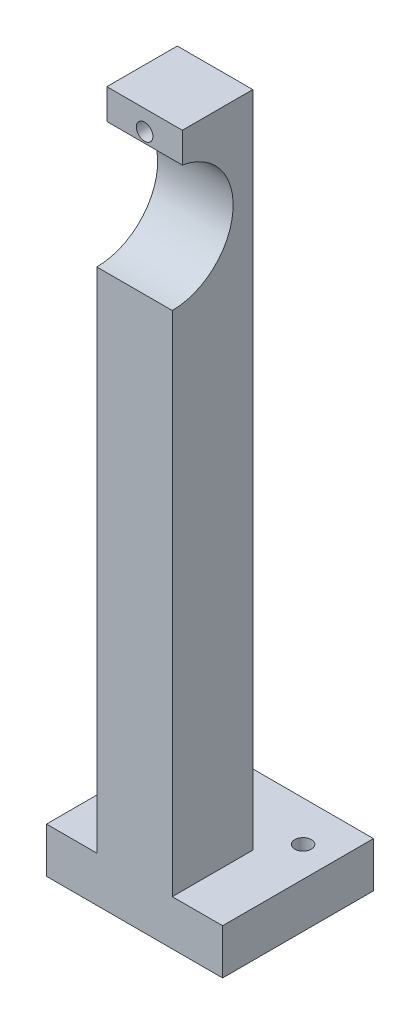
from build123d import *

# Parameters (mm, degrees)
SKETCH_2_W                 = 240.549430728
SKETCH_2_H                 = 149.540933388
EXTRUDE_1_DEPTH            = 5
SKETCH_6_W                 = 93.246571425
SKETCH_6_H                 = 149.540933388
EXTRUDE_4_DEPTH            = 5
SKETCH_8_W                 = 274.716709757
SKETCH_8_H                 = 58.51354913
EXTRUDE_6_DEPTH            = 5
CUT_EXTRUDE_2_DEPTH        = 252.755772101
CUT_EXTRUDE_2_DEPTH_BACK   = 252.755772101
SKETCH_9_W                 = 59.079292396
SKETCH_9_H                 = 149.540933388
SKETCH_10_W                = 104.703380117
SKETCH_10_H                = 208.054482518
CUT_EXTRUDE_3_DEPTH        = 10
SKETCH_12_W                = 200
SKETCH_12_H                = 200
EXTRUDE_7_DEPTH            = 5
SKETCH_13_OUTSIDE_W        = 259.728
SKETCH_13_OUTSIDE_H        = 267.782
SKETCH_13_OUTSIDE_W_2      = 200
SKETCH_13_OUTSIDE_H_2      = 200
CUT_EXTRUDE_4_DEPTH        = 278.64321362
EXTRUDE_START              = -75
SKETCH_18_R                = 5.25
EXTRUDE_9_DEPTH            = 10
EXTRUDE_START_2            = -46
EXTRUDE_10_DEPTH           = 15
EXTRUDE_START_3            = -91.2
EXTRUDE_11_DEPTH           = 15
EXTRUDE_12_REACH           = 307.894
SKETCH_20_R                = 5.25
SKETCH_26_W                = 200
SKETCH_26_H                = 5
EXTRUDE_13_DEPTH           = 100
SKETCH_27_W                = 200
SKETCH_27_H                = 5
CUT_EXTRUDE_5_DEPTH        = 30
EXTRUDE_14_DEPTH           = 10
SKETCH_29_W                = 60
SKETCH_29_H                = 9
EXTRUDE_15_DEPTH           = 10
HOLE_WIZARD_M4_1_D         = 3.3
HOLE_WIZARD_M4_2_D         = 3.3
HOLE_WIZARD_M4_3_D         = 3.3
EXTRUDE_16_DEPTH           = 10
SKETCH_37_W                = 60
SKETCH_37_H                = 9
EXTRUDE_17_DEPTH           = 10
HOLE_WIZARD_M4_4_D         = 3.3
EXTRUDE_START_4            = -3.5
SKETCH_40_R                = 5.25
SKETCH_40_R_2              = 3.25
EXTRUDE_18_DEPTH           = 46.5
CUT_EXTRUDE_START          = -3.5
SKETCH_41_R                = 5.25
SKETCH_41_R_2              = 3.25
CUT_EXTRUDE_6_DEPTH        = 3.5
HOLE_WIZARD_M4_5_OUTLINE_R = 1.65
HOLE_WIZARD_M4_5_DEPTH     = 14
CUT_EXTRUDE_7_DEPTH        = 400.170489639
CUT_EXTRUDE_7_DEPTH_BACK   = 400.170489639
SKETCH_44_W                = 15
SKETCH_44_H                = 131.085631965
SKETCH_44_W_2              = 270
SKETCH_44_H_2              = 5
CUT_EXTRUDE_START_2        = -16
CUT_EXTRUDE_8_DEPTH        = 30


# Read off the part's stored shape, not the designer's step: M4 螺纹孔5
with BuildPart() as part:
    # 草图2 → 凸台-拉伸1 (new body)
    with BuildSketch(Plane(origin=(0, 0, 0), x_dir=(1, 0, 0), z_dir=(0, 1, 0))):
        Rectangle(SKETCH_2_W, SKETCH_2_H)
    extrude(amount=EXTRUDE_1_DEPTH)

    # 草图6 → 凸台-拉伸4 (add)
    with BuildSketch(Plane(origin=(0, 5, 0), x_dir=(1, 0, 0), z_dir=(0, 1, 0))):
        with Locations((166.898001077, 0)):
            Rectangle(SKETCH_6_W, SKETCH_6_H)
    extrude(amount=-EXTRUDE_4_DEPTH)

    # 草图8 → 凸台-拉伸6 (add)
    with BuildSketch(Plane(origin=(0, 5, 0), x_dir=(1, 0, 0), z_dir=(0, 1, 0))):
        with Locations((76.162931911, -104.027241259)):
            Rectangle(SKETCH_8_W, SKETCH_8_H)
    extrude(amount=-EXTRUDE_6_DEPTH)

    # 草图9 → 切除-拉伸2 (cut, two sides: drawn at the far end of the back side and taken through both)
    with BuildSketch(Plane(origin=(0, 5, 0), x_dir=(1, 0, 0), z_dir=(0, 1, 0)).offset(-CUT_EXTRUDE_2_DEPTH_BACK)):
        with Locations((-90.735069166, 0)):
            Rectangle(SKETCH_9_W, SKETCH_9_H)
    extrude(amount=CUT_EXTRUDE_2_DEPTH + CUT_EXTRUDE_2_DEPTH_BACK, mode=Mode.SUBTRACT)

    # 草图10 → 切除-拉伸3 (cut)
    with BuildSketch(Plane(origin=(0, 5, 0), x_dir=(1, 0, 0), z_dir=(0, 1, 0))):
        with Locations((-8.84373291, -29.256774565)):
            Rectangle(SKETCH_10_W, SKETCH_10_H)
    extrude(amount=-CUT_EXTRUDE_3_DEPTH, mode=Mode.SUBTRACT)

    # 草图12 → 凸台-拉伸7 (add)
    with BuildSketch(Plane(origin=(0, 5, 0), x_dir=(1, 0, 0), z_dir=(0, 1, 0))):
        with Locations((143.507957149, -25.229533306)):
            Rectangle(SKETCH_12_W, SKETCH_12_H)
    extrude(amount=-EXTRUDE_7_DEPTH)

    # 草图13 outside → 切除-拉伸4 (cut, through all)
    with BuildSketch(Plane(origin=(0, 5, 0), x_dir=(1, 0, 0), z_dir=(0, 1, 0))):
        with Locations((143.508, -29.257)):
            Rectangle(SKETCH_13_OUTSIDE_W, SKETCH_13_OUTSIDE_H)
        with Locations((143.507957149, -25.229533306)):
            Rectangle(SKETCH_13_OUTSIDE_W_2, SKETCH_13_OUTSIDE_H_2, mode=Mode.SUBTRACT)
    extrude(amount=-CUT_EXTRUDE_4_DEPTH, mode=Mode.SUBTRACT)

    # 草图18 → 凸台-拉伸9 (add)
    with BuildSketch(Plane.XY.offset(125.229533306).offset(EXTRUDE_START)):
        with BuildLine():
            Line((95.507957149, 14), (95.507957149, 125))
            ThreePointArc((95.507957149, 125), (88.507957149, 132), (81.507957149, 125))
            Line((81.507957149, 125), (81.507957149, 14))
            Line((81.507957149, 14), (68.507957149, 14))
            Line((68.507957149, 14), (68.507957149, 5))
            Line((68.507957149, 5), (108.507957149, 5))
            Line((108.507957149, 5), (108.507957149, 14))
            Line((108.507957149, 14), (95.507957149, 14))
        make_face()
        with Locations((88.507957149, 125)):
            Circle(SKETCH_18_R, mode=Mode.SUBTRACT)
    extrude_9 = extrude(amount=-EXTRUDE_9_DEPTH)

    # 镜向1: 凸台-拉伸9 across plane
    add(extrude_9.mirror(Plane.XY.offset(25.229533306)))

    # 草图16 → 凸台-拉伸10 (add)
    with BuildSketch(Plane(origin=(243.507957149, 0, 0), x_dir=(0, 0, -1), z_dir=(1, 0, 0)).offset(EXTRUDE_START_2)):
        with BuildLine():
            Line((-53.779533306, 14), (-53.779533306, 145.085631965))
            Line((-53.779533306, 145.085631965), (-67.779533306, 145.085631965))
            Line((-67.779533306, 145.085631965), (-67.779533306, 139.085631965))
            ThreePointArc((-67.779533306, 139.085631965), (-69.779533306, 114.75), (-71.779533306, 139.085631965))
            Line((-71.779533306, 139.085631965), (-71.779533306, 145.085631965))
            Line((-71.779533306, 145.085631965), (-85.779533306, 145.085631965))
            Line((-85.779533306, 145.085631965), (-85.779533306, 14))
            Line((-85.779533306, 14), (-99.779533306, 14))
            Line((-99.779533306, 14), (-99.779533306, 5))
            Line((-99.779533306, 5), (-39.779533306, 5))
            Line((-39.779533306, 5), (-39.779533306, 14))
            Line((-39.779533306, 14), (-53.779533306, 14))
        make_face()
    extrude(amount=-EXTRUDE_10_DEPTH)

    # 草图19 → 凸台-拉伸11 (add)
    with BuildSketch(Plane(origin=(243.507957149, 0, 0), x_dir=(0, 0, -1), z_dir=(1, 0, 0)).offset(EXTRUDE_START_3)):
        with BuildLine():
            Line((37.990466694, 14), (37.990466694, 144.933566106))
            Line((37.990466694, 144.933566106), (23.990466694, 144.933566106))
            Line((23.990466694, 144.933566106), (23.990466694, 138.933566106))
            ThreePointArc((23.990466694, 138.933566106), (21.990466694, 114.9), (19.990466694, 138.933566106))
            Line((19.990466694, 138.933566106), (19.990466694, 144.933566106))
            Line((19.990466694, 144.933566106), (5.990466694, 144.933566106))
            Line((5.990466694, 144.933566106), (5.990466694, 14))
            Line((5.990466694, 14), (-8.009533306, 14))
            Line((-8.009533306, 14), (-8.009533306, 5))
            Line((-8.009533306, 5), (51.990466694, 5))
            Line((51.990466694, 5), (51.990466694, 14))
            Line((51.990466694, 14), (37.990466694, 14))
        make_face()
    extrude(amount=-EXTRUDE_11_DEPTH)

    # 草图20 → 凸台-拉伸12 (add, up to next)
    with BuildSketch(Plane(origin=(0, 0, 40.229533306), x_dir=(-1, 0, 0), z_dir=(0, 0, -1)), mode=Mode.PRIVATE) as extrude_12_sk1:
        with BuildLine():
            Line((-108.507957149, 5), (-68.507957149, 5))
            Line((-68.507957149, 5), (-68.507957149, 14))
            Line((-68.507957149, 14), (-81.507957149, 14))
            Line((-81.507957149, 14), (-81.507957149, 125))
            ThreePointArc((-81.507957149, 125), (-88.507957149, 132), (-95.507957149, 125))
            Line((-95.507957149, 125), (-95.507957149, 14))
            Line((-95.507957149, 14), (-108.507957149, 14))
            Line((-108.507957149, 14), (-108.507957149, 5))
        make_face()
        with Locations(Location((-88.507957149, 125, 0), (0, 0, 180))):
            Circle(SKETCH_20_R, mode=Mode.SUBTRACT)
    extrude_12_tool1 = extrude(extrude_12_sk1.sketch, amount=EXTRUDE_12_REACH, mode=Mode.PRIVATE) - part.part
    add(extrude_12_tool1.solids().sort_by_distance((88.507957, 57.997401, 40.229533))[0])

    # 草图26 → 凸台-拉伸13 (add)
    with BuildSketch(Plane(origin=(243.507957149, 0, 0), x_dir=(0, 0, -1), z_dir=(1, 0, 0))):
        with Locations((-25.229533306, 2.5)):
            Rectangle(SKETCH_26_W, SKETCH_26_H)
    extrude(amount=EXTRUDE_13_DEPTH)

    # 草图27 → 切除-拉伸5 (cut)
    with BuildSketch(Plane(origin=(343.507957149, 0, 0), x_dir=(0, 0, -1), z_dir=(1, 0, 0))):
        with Locations((-25.229533306, 2.5)):
            Rectangle(SKETCH_27_W, SKETCH_27_H)
    extrude(amount=-CUT_EXTRUDE_5_DEPTH, mode=Mode.SUBTRACT)

    # 草图28 → 凸台-拉伸14 (add)
    with BuildSketch(Plane(origin=(197.507957149, 0, 0), x_dir=(0, 0, -1), z_dir=(1, 0, 0))):
        Polygon((-85.779533306, 14), (-53.779533306, 14), (-39.779533306, 14), (-39.779533306, 5), (-99.779533306, 5), (-99.779533306, 14), align=None)
    extrude(amount=EXTRUDE_14_DEPTH)

    # 草图29 → 凸台-拉伸15 (add)
    with BuildSketch(Plane.ZY.offset(-182.507957149)):
        with Locations((69.779533306, 9.5)):
            Rectangle(SKETCH_29_W, SKETCH_29_H)
    extrude(amount=EXTRUDE_15_DEPTH)

    # M4 螺纹孔1 (through all)
    with Locations(Plane(origin=(0, 14, 0), x_dir=(1, 0, 0), z_dir=(0, 1, 0))):
        with Locations((178.507957149, -47.779533306), (201.507957149, -47.779533306), (201.507957149, -91.779533306), (178.507957149, -91.779533306)):
            Hole(HOLE_WIZARD_M4_1_D / 2)

    # M4 螺纹孔2 (through all)
    with Locations(Plane.XY.offset(85.779533306)):
        with Locations((190.007957149, 141.085631965)):
            Hole(HOLE_WIZARD_M4_2_D / 2)

    # M4 螺纹孔3 (through all)
    with Locations(Plane.XY.offset(-5.990466694)):
        with Locations((144.807957149, 140.933566106)):
            Hole(HOLE_WIZARD_M4_3_D / 2)

    # 草图36 → 凸台-拉伸16 (add)
    with BuildSketch(Plane(origin=(152.307957149, 0, 0), x_dir=(0, 0, -1), z_dir=(1, 0, 0))):
        Polygon((5.990466694, 14), (37.990466694, 14), (51.990466694, 14), (51.990466694, 5), (-8.009533306, 5), (-8.009533306, 14), align=None)
    extrude(amount=EXTRUDE_16_DEPTH)

    # 草图37 → 凸台-拉伸17 (add)
    with BuildSketch(Plane.ZY.offset(-137.307957149)):
        with Locations((-21.990466694, 9.5)):
            Rectangle(SKETCH_37_W, SKETCH_37_H)
    extrude(amount=EXTRUDE_17_DEPTH)

    # M4 螺纹孔4 (through all)
    with Locations(Plane(origin=(0, 14, 0), x_dir=(1, 0, 0), z_dir=(0, 1, 0))):
        with Locations((133.307957149, 43.990466694), (156.307957149, 43.990466694), (156.307957149, -0.009533306), (133.307957149, -0.009533306)):
            Hole(HOLE_WIZARD_M4_4_D / 2)

    # 草图40 → 凸台-拉伸18 (add)
    with BuildSketch(Plane.XY.offset(50.229533306).offset(EXTRUDE_START_4)):
        with Locations((88.507957149, 125)):
            Circle(SKETCH_40_R)
        with Locations((88.507957149, 125)):
            Circle(SKETCH_40_R_2, mode=Mode.SUBTRACT)
    extrude(amount=-EXTRUDE_18_DEPTH)

    # 草图41 → 切除-拉伸6 (cut)
    with BuildSketch(Plane(origin=(0, 0, 0.229533306), x_dir=(-1, 0, 0), z_dir=(0, 0, -1)).offset(CUT_EXTRUDE_START)):
        with Locations(Location((-88.507957149, 125, 0), (0, 0, 180))):
            Circle(SKETCH_41_R)
        with Locations(Location((-88.507957149, 125, 0), (0, 0, 180))):
            Circle(SKETCH_41_R_2, mode=Mode.SUBTRACT)
    extrude(amount=CUT_EXTRUDE_6_DEPTH, mode=Mode.SUBTRACT)

    # M4 螺纹孔5 outline → M4 螺纹孔5 (cut)
    with BuildSketch(Plane(origin=(0, 0, 0), x_dir=(1, 0, 0), z_dir=(0, 1, 0))):
        with Locations((73.507957149, -42.229533306)):
            Circle(HOLE_WIZARD_M4_5_OUTLINE_R)
        with Locations((103.507957149, -42.229533306)):
            Circle(HOLE_WIZARD_M4_5_OUTLINE_R)
        with Locations((103.507957149, -8.229533306)):
            Circle(HOLE_WIZARD_M4_5_OUTLINE_R)
        with Locations((73.507957149, -8.229533306)):
            Circle(HOLE_WIZARD_M4_5_OUTLINE_R)
    extrude(amount=HOLE_WIZARD_M4_5_DEPTH, mode=Mode.SUBTRACT)

    # 草图44 → 切除-拉伸7 (cut, two sides: drawn at the far end of the back side and taken through both)
    with BuildSketch(Plane.XY.offset(125.229533306).offset(-CUT_EXTRUDE_7_DEPTH_BACK)):
        with Locations((190.007957149, 79.542815983)):
            Rectangle(SKETCH_44_W, SKETCH_44_H)
        Polygon((172.507957149, 14), (172.507957149, 5), (207.507957149, 5), (207.507957149, 14), (197.507957149, 14), (182.507957149, 14), align=None)
        with BuildLine():
            Line((68.507957149, 5), (108.507957149, 5))
            Line((108.507957149, 5), (108.507957149, 14))
            Line((108.507957149, 14), (95.507957149, 14))
            Line((95.507957149, 14), (95.507957149, 125))
            ThreePointArc((95.507957149, 125), (88.507957149, 132), (81.507957149, 125))
            Line((81.507957149, 125), (81.507957149, 14))
            Line((81.507957149, 14), (68.507957149, 14))
            Line((68.507957149, 14), (68.507957149, 5))
        make_face()
        with Locations((178.507957149, 2.5)):
            Rectangle(SKETCH_44_W_2, SKETCH_44_H_2)
    extrude(amount=CUT_EXTRUDE_7_DEPTH + CUT_EXTRUDE_7_DEPTH_BACK, mode=Mode.SUBTRACT)

    # 草图45 → 切除-拉伸8 (cut)
    with BuildSketch(Plane.XY.offset(-5.990466694).offset(CUT_EXTRUDE_START_2)):
        Polygon((137.307957149, 14), (127.307957149, 14), (127.307957149, 5), (162.307957149, 5), (162.307957149, 14), (152.307957149, 14), (152.307957149, 144.933566106), (137.307957149, 144.933566106), align=None)
    extrude(amount=CUT_EXTRUDE_8_DEPTH, mode=Mode.SUBTRACT)


solid = part.part
